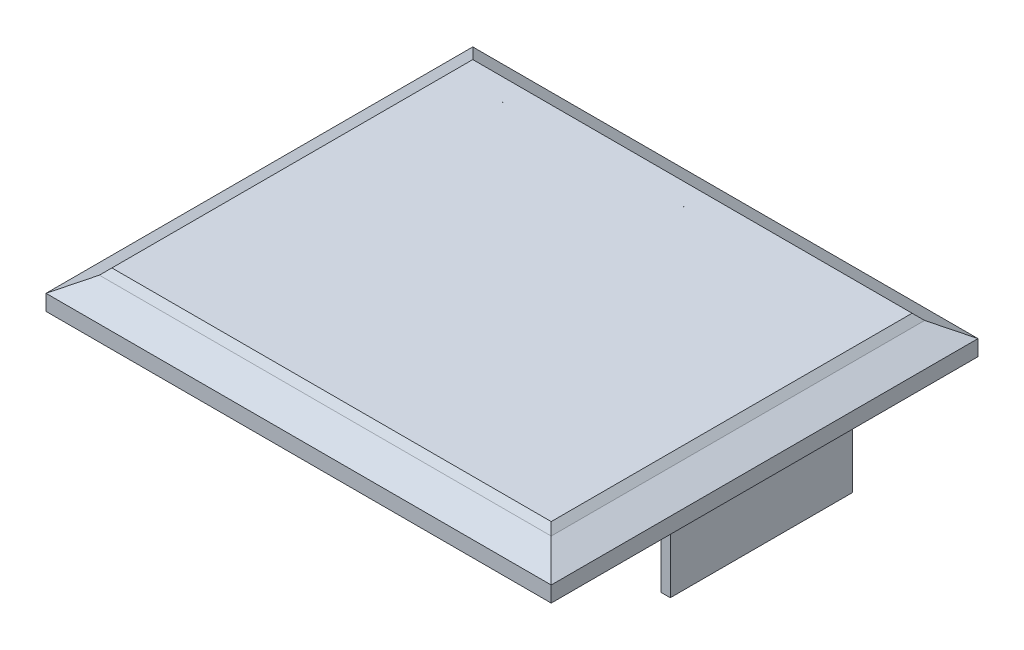
from build123d import *

# Parameters (mm, degrees)
SKETCH1_W           = 161
SKETCH1_H           = 136
BOSS_EXTRUDE1_DEPTH = 5
BOSS_EXTRUDE2_START = -10
SKETCH1_13_W        = 144
SKETCH1_13_H        = 119
BOSS_EXTRUDE2_DEPTH = 2
LOFT1_OUTLINE_W     = 144
LOFT1_OUTLINE_H     = 119
LOFT1_DEPTH         = 5
LOFT1_TAPER         = -59.5344551
CHAMFER1_SIZE       = 2
SKETCH1_14_W        = 144
SKETCH1_14_H        = 119
CUT_EXTRUDE1_DEPTH  = 8
CHAMFER2_SIZE       = 5
SKETCH1_15_W        = 38
SKETCH1_15_H        = 3
SKETCH1_15_W_2      = 3
SKETCH1_15_H_2      = 58
SKETCH1_15_H_3      = 28.62212407
BOSS_EXTRUDE3_DEPTH = 20
SKETCH1_18_R        = 6
CUT_EXTRUDE3_DEPTH  = 5.25
FILLET1_SIZE        = 2


with BuildPart() as part:
    # Sketch1 → Boss-Extrude1 (new body)
    with BuildSketch(Plane.XZ):
        with Locations((-6.029029402, -17.231063311)):
            Rectangle(SKETCH1_W, SKETCH1_H)
    extrude(amount=-BOSS_EXTRUDE1_DEPTH)

    # Loft1: read off the stored shape, not the designer's step
    # Loft1 outline → Loft1 (add)
    with BuildSketch(Plane(origin=(0, 10, 0), x_dir=(1, 0, 0), z_dir=(0, 1, 0))):
        with Locations((-6.029029402, 17.231063311)):
            Rectangle(LOFT1_OUTLINE_W, LOFT1_OUTLINE_H)
    extrude(amount=-LOFT1_DEPTH, taper=LOFT1_TAPER)

    # Sketch1<14> → Cut-Extrude1 (cut)
    with BuildSketch(Plane.XZ):
        with Locations((-6.029029402, -17.231063311)):
            Rectangle(SKETCH1_14_W, SKETCH1_14_H)
    extrude(amount=-CUT_EXTRUDE1_DEPTH, mode=Mode.SUBTRACT)

    # Chamfer2
    chamfer2_edges = [part.edges().sort_by_distance(p)[0] for p in [
        (-78.029029402, 8, -17.231063311),
        (-6.029029402, 8, 42.268936689),
        (65.970970598, 8, -17.231063311),
        (-6.029029402, 8, -76.731063311),
    ]]
    chamfer(chamfer2_edges, length=CHAMFER2_SIZE)

    # Sketch1<15> → Boss-Extrude3 (add)
    with BuildSketch(Plane.XZ):
        with Locations((2.342857194, -81.231063311)):
            Rectangle(SKETCH1_15_W, SKETCH1_15_H)
        with Locations((70.470970598, -18.679811546)):
            Rectangle(SKETCH1_15_W_2, SKETCH1_15_H_2)
        with Locations((-82.529029402, -5.323504441)):
            Rectangle(SKETCH1_15_W_2, SKETCH1_15_H_3)
    extrude(amount=BOSS_EXTRUDE3_DEPTH)

    # Sketch1<18> → Cut-Extrude3 (cut)
    with BuildSketch(Plane.XZ):
        with Locations((65.970970598, 42.268936689)):
            Circle(SKETCH1_18_R)
        with Locations((-78.029029402, 42.268936689)):
            Circle(SKETCH1_18_R)
        with Locations((-78.029029402, -76.731063311)):
            Circle(SKETCH1_18_R)
        with Locations((65.970970598, -76.731063311)):
            Circle(SKETCH1_18_R)
    extrude(amount=-CUT_EXTRUDE3_DEPTH, mode=Mode.SUBTRACT)

    # Fillet1
    # a fillet whose section is not a circle: 2 mm, written as the material it adds along each edge
    with BuildSketch(Plane(origin=(-16.657142806, 0, -82.731063311), x_dir=(0, 0, -1), z_dir=(1, 0, 0)), Plane(origin=(21.342857194, 0, -79.731063311), x_dir=(0, 0, 1), z_dir=(-1, 0, 0))) as fillet1_piece_1:
        with BuildLine():
            Bezier((FILLET1_SIZE, 0), (0, 0), (0, -FILLET1_SIZE), weights=[1, 0.428571429, 1])
            Line((0, -FILLET1_SIZE), (0, 0))
            Line((0, 0), (FILLET1_SIZE, 0))
        make_face()
    extrude(amount=38)
    with BuildSketch(Plane(origin=(-84.029029402, 0, 8.987557594), x_dir=(-1, 0, 0), z_dir=(0, 0, -1)), Plane(origin=(-81.029029402, 0, -19.634566476), x_dir=(1, 0, 0), z_dir=(0, 0, 1))) as fillet1_piece_2:
        with BuildLine():
            Bezier((FILLET1_SIZE, 0), (0, 0), (0, -FILLET1_SIZE), weights=[1, 0.428571429, 1])
            Line((0, -FILLET1_SIZE), (0, 0))
            Line((0, 0), (FILLET1_SIZE, 0))
        make_face()
    extrude(amount=28.62212407)
    with BuildSketch(Plane(origin=(71.970970598, 0, -47.679811546), x_dir=(1, 0, 0), z_dir=(0, 0, 1)), Plane(origin=(68.970970598, 0, 10.320188454), x_dir=(-1, 0, 0), z_dir=(0, 0, -1))) as fillet1_piece_3:
        with BuildLine():
            Bezier((FILLET1_SIZE, 0), (0, 0), (0, -FILLET1_SIZE), weights=[1, 0.428571429, 1])
            Line((0, -FILLET1_SIZE), (0, 0))
            Line((0, 0), (FILLET1_SIZE, 0))
        make_face()
    extrude(amount=58)
    with BuildSketch(Plane(origin=(-78.029029402, 5.25, 42.268936689), x_dir=(0.7048818539423626, 0, -0.7093247295722728), z_dir=(0.7093247295722728, 0, 0.7048818539423626))) as fillet1_piece_4_section:
        with BuildLine():
            Bezier((6 - FILLET1_SIZE, 0), (6, 0), (6, -FILLET1_SIZE), weights=[1, 0.428571429, 1])
            Line((6, -FILLET1_SIZE), (6, 0))
            Line((6, 0), (6 - FILLET1_SIZE, 0))
        make_face()
    fillet1_piece_4 = revolve(axis=Axis((-78.029029402, 5.25, 42.268936689), (0, 1, 0)), revolution_arc=359.64, mode=Mode.PRIVATE)
    fillet1_piece_4 = split(fillet1_piece_4, bisect_by=Plane(origin=(-78.029029402, 4.125, 41.143936689), z_dir=(0, -0.7071067811865476, -0.7071067811865476)), keep=Keep.TOP, mode=Mode.PRIVATE)
    fillet1_piece_4 = split(fillet1_piece_4, bisect_by=Plane(origin=(-76.904029402, 4.125, 42.268936689), z_dir=(-0.7071067811865476, 0.7071067811865476, 0)), keep=Keep.TOP, mode=Mode.PRIVATE)
    add(fillet1_piece_4)
    with BuildSketch(Plane(origin=(-78.029029402, 5.25, 42.268936689), x_dir=(0.7048818539423626, 0, -0.7093247295722728), z_dir=(0.7093247295722728, 0, 0.7048818539423626))) as fillet1_piece_5_section:
        with BuildLine():
            Bezier((6 - FILLET1_SIZE, 0), (6, 0), (6, -FILLET1_SIZE), weights=[1, 0.428571429, 1])
            Line((6, -FILLET1_SIZE), (6, 0))
            Line((6, 0), (6 - FILLET1_SIZE, 0))
        make_face()
    fillet1_piece_5 = revolve(axis=Axis((-78.029029402, 5.25, 42.268936689), (0, 1, 0)), revolution_arc=359.64, mode=Mode.PRIVATE)
    fillet1_piece_5 = split(fillet1_piece_5, bisect_by=Plane(origin=(-78.029029402, 4.125, 41.143936689), z_dir=(0, 0.7071067811865476, 0.7071067811865476)), keep=Keep.TOP, mode=Mode.PRIVATE)
    fillet1_piece_5 = split(fillet1_piece_5, bisect_by=Plane(origin=(-76.904029402, 4.125, 42.268936689), z_dir=(-0.7071067811865476, 0.7071067811865476, 0)), keep=Keep.TOP, mode=Mode.PRIVATE)
    add(fillet1_piece_5)
    with BuildSketch(Plane(origin=(-78.029029402, 5.25, 42.268936689), x_dir=(0.7048818539423626, 0, -0.7093247295722728), z_dir=(0.7093247295722728, 0, 0.7048818539423626))) as fillet1_piece_6_section:
        with BuildLine():
            Bezier((6 - FILLET1_SIZE, 0), (6, 0), (6, -FILLET1_SIZE), weights=[1, 0.428571429, 1])
            Line((6, -FILLET1_SIZE), (6, 0))
            Line((6, 0), (6 - FILLET1_SIZE, 0))
        make_face()
    fillet1_piece_6 = revolve(axis=Axis((-78.029029402, 5.25, 42.268936689), (0, 1, 0)), revolution_arc=359.64, mode=Mode.PRIVATE)
    fillet1_piece_6 = split(fillet1_piece_6, bisect_by=Plane(origin=(-78.029029402, 4.125, 41.143936689), z_dir=(0, 0.7071067811865476, 0.7071067811865476)), keep=Keep.TOP, mode=Mode.PRIVATE)
    fillet1_piece_6 = split(fillet1_piece_6, bisect_by=Plane(origin=(-76.904029402, 4.125, 42.268936689), z_dir=(0.7071067811865476, -0.7071067811865476, 0)), keep=Keep.TOP, mode=Mode.PRIVATE)
    add(fillet1_piece_6)
    with BuildSketch(Plane(origin=(65.970970598, 5.25, 42.268936689), x_dir=(-0.7093247295722728, 0, -0.7048818539423626), z_dir=(0.7048818539423626, 0, -0.7093247295722728))) as fillet1_piece_7_section:
        with BuildLine():
            Bezier((6 - FILLET1_SIZE, 0), (6, 0), (6, -FILLET1_SIZE), weights=[1, 0.428571429, 1])
            Line((6, -FILLET1_SIZE), (6, 0))
            Line((6, 0), (6 - FILLET1_SIZE, 0))
        make_face()
    fillet1_piece_7 = revolve(axis=Axis((65.970970598, 5.25, 42.268936689), (0, 1, 0)), revolution_arc=359.64, mode=Mode.PRIVATE)
    fillet1_piece_7 = split(fillet1_piece_7, bisect_by=Plane(origin=(65.970970598, 4.125, 41.143936689), z_dir=(0, 0.7071067811865476, 0.7071067811865476)), keep=Keep.TOP, mode=Mode.PRIVATE)
    fillet1_piece_7 = split(fillet1_piece_7, bisect_by=Plane(origin=(64.845970598, 4.125, 42.268936689), z_dir=(-0.7071067811865476, -0.7071067811865476, 0)), keep=Keep.TOP, mode=Mode.PRIVATE)
    add(fillet1_piece_7)
    with BuildSketch(Plane(origin=(65.970970598, 5.25, 42.268936689), x_dir=(-0.7093247295722728, 0, -0.7048818539423626), z_dir=(0.7048818539423626, 0, -0.7093247295722728))) as fillet1_piece_8_section:
        with BuildLine():
            Bezier((6 - FILLET1_SIZE, 0), (6, 0), (6, -FILLET1_SIZE), weights=[1, 0.428571429, 1])
            Line((6, -FILLET1_SIZE), (6, 0))
            Line((6, 0), (6 - FILLET1_SIZE, 0))
        make_face()
    fillet1_piece_8 = revolve(axis=Axis((65.970970598, 5.25, 42.268936689), (0, 1, 0)), revolution_arc=359.64, mode=Mode.PRIVATE)
    fillet1_piece_8 = split(fillet1_piece_8, bisect_by=Plane(origin=(65.970970598, 4.125, 41.143936689), z_dir=(0, 0.7071067811865476, 0.7071067811865476)), keep=Keep.TOP, mode=Mode.PRIVATE)
    fillet1_piece_8 = split(fillet1_piece_8, bisect_by=Plane(origin=(64.845970598, 4.125, 42.268936689), z_dir=(0.7071067811865476, 0.7071067811865476, 0)), keep=Keep.TOP, mode=Mode.PRIVATE)
    add(fillet1_piece_8)
    with BuildSketch(Plane(origin=(65.970970598, 5.25, 42.268936689), x_dir=(-0.7093247295722728, 0, -0.7048818539423626), z_dir=(0.7048818539423626, 0, -0.7093247295722728))) as fillet1_piece_9_section:
        with BuildLine():
            Bezier((6 - FILLET1_SIZE, 0), (6, 0), (6, -FILLET1_SIZE), weights=[1, 0.428571429, 1])
            Line((6, -FILLET1_SIZE), (6, 0))
            Line((6, 0), (6 - FILLET1_SIZE, 0))
        make_face()
    fillet1_piece_9 = revolve(axis=Axis((65.970970598, 5.25, 42.268936689), (0, 1, 0)), revolution_arc=359.64, mode=Mode.PRIVATE)
    fillet1_piece_9 = split(fillet1_piece_9, bisect_by=Plane(origin=(65.970970598, 4.125, 41.143936689), z_dir=(0, -0.7071067811865476, -0.7071067811865476)), keep=Keep.TOP, mode=Mode.PRIVATE)
    fillet1_piece_9 = split(fillet1_piece_9, bisect_by=Plane(origin=(64.845970598, 4.125, 42.268936689), z_dir=(0.7071067811865476, 0.7071067811865476, 0)), keep=Keep.TOP, mode=Mode.PRIVATE)
    add(fillet1_piece_9)
    with BuildSketch(Plane(origin=(-78.029029402, 5.25, -76.731063311), x_dir=(0.7093247295722739, 0, 0.7048818539423612), z_dir=(-0.7048818539423612, 0, 0.7093247295722739))) as fillet1_piece_10_section:
        with BuildLine():
            Bezier((6, -FILLET1_SIZE), (6, 0), (6 - FILLET1_SIZE, 0), weights=[1, 0.428571429, 1])
            Line((6 - FILLET1_SIZE, 0), (6, 0))
            Line((6, 0), (6, -FILLET1_SIZE))
        make_face()
    fillet1_piece_10 = revolve(axis=Axis((-78.029029402, 5.25, -76.731063311), (0, 1, 0)), revolution_arc=359.64, mode=Mode.PRIVATE)
    fillet1_piece_10 = split(fillet1_piece_10, bisect_by=Plane(origin=(-76.904029402, 4.125, -76.731063311), z_dir=(0.7071067811865476, -0.7071067811865476, 0)), keep=Keep.TOP, mode=Mode.PRIVATE)
    fillet1_piece_10 = split(fillet1_piece_10, bisect_by=Plane(origin=(-78.029029402, 4.125, -75.606063311), z_dir=(0, 0.7071067811865476, -0.7071067811865476)), keep=Keep.TOP, mode=Mode.PRIVATE)
    add(fillet1_piece_10)
    with BuildSketch(Plane(origin=(-78.029029402, 5.25, -76.731063311), x_dir=(0.7093247295722739, 0, 0.7048818539423612), z_dir=(-0.7048818539423612, 0, 0.7093247295722739))) as fillet1_piece_11_section:
        with BuildLine():
            Bezier((6, -FILLET1_SIZE), (6, 0), (6 - FILLET1_SIZE, 0), weights=[1, 0.428571429, 1])
            Line((6 - FILLET1_SIZE, 0), (6, 0))
            Line((6, 0), (6, -FILLET1_SIZE))
        make_face()
    fillet1_piece_11 = revolve(axis=Axis((-78.029029402, 5.25, -76.731063311), (0, 1, 0)), revolution_arc=359.64, mode=Mode.PRIVATE)
    fillet1_piece_11 = split(fillet1_piece_11, bisect_by=Plane(origin=(-76.904029402, 4.125, -76.731063311), z_dir=(-0.7071067811865476, 0.7071067811865476, 0)), keep=Keep.TOP, mode=Mode.PRIVATE)
    fillet1_piece_11 = split(fillet1_piece_11, bisect_by=Plane(origin=(-78.029029402, 4.125, -75.606063311), z_dir=(0, 0.7071067811865476, -0.7071067811865476)), keep=Keep.TOP, mode=Mode.PRIVATE)
    add(fillet1_piece_11)
    with BuildSketch(Plane(origin=(-78.029029402, 5.25, -76.731063311), x_dir=(0.7093247295722739, 0, 0.7048818539423612), z_dir=(-0.7048818539423612, 0, 0.7093247295722739))) as fillet1_piece_12_section:
        with BuildLine():
            Bezier((6, -FILLET1_SIZE), (6, 0), (6 - FILLET1_SIZE, 0), weights=[1, 0.428571429, 1])
            Line((6 - FILLET1_SIZE, 0), (6, 0))
            Line((6, 0), (6, -FILLET1_SIZE))
        make_face()
    fillet1_piece_12 = revolve(axis=Axis((-78.029029402, 5.25, -76.731063311), (0, 1, 0)), revolution_arc=359.64, mode=Mode.PRIVATE)
    fillet1_piece_12 = split(fillet1_piece_12, bisect_by=Plane(origin=(-76.904029402, 4.125, -76.731063311), z_dir=(-0.7071067811865476, 0.7071067811865476, 0)), keep=Keep.TOP, mode=Mode.PRIVATE)
    fillet1_piece_12 = split(fillet1_piece_12, bisect_by=Plane(origin=(-78.029029402, 4.125, -75.606063311), z_dir=(0, -0.7071067811865476, 0.7071067811865476)), keep=Keep.TOP, mode=Mode.PRIVATE)
    add(fillet1_piece_12)
    with BuildSketch(Plane(origin=(65.970970598, 5.25, -76.731063311), x_dir=(-0.7048818539423612, 0, 0.7093247295722739), z_dir=(-0.7093247295722739, 0, -0.7048818539423612))) as fillet1_piece_13_section:
        with BuildLine():
            Bezier((6, -FILLET1_SIZE), (6, 0), (6 - FILLET1_SIZE, 0), weights=[1, 0.428571429, 1])
            Line((6 - FILLET1_SIZE, 0), (6, 0))
            Line((6, 0), (6, -FILLET1_SIZE))
        make_face()
    fillet1_piece_13 = revolve(axis=Axis((65.970970598, 5.25, -76.731063311), (0, 1, 0)), revolution_arc=359.64, mode=Mode.PRIVATE)
    fillet1_piece_13 = split(fillet1_piece_13, bisect_by=Plane(origin=(64.845970598, 4.125, -76.731063311), z_dir=(0.7071067811865476, 0.7071067811865476, 0)), keep=Keep.TOP, mode=Mode.PRIVATE)
    fillet1_piece_13 = split(fillet1_piece_13, bisect_by=Plane(origin=(65.970970598, 4.125, -75.606063311), z_dir=(0, -0.7071067811865476, 0.7071067811865476)), keep=Keep.TOP, mode=Mode.PRIVATE)
    add(fillet1_piece_13)
    with BuildSketch(Plane(origin=(65.970970598, 5.25, -76.731063311), x_dir=(-0.7048818539423612, 0, 0.7093247295722739), z_dir=(-0.7093247295722739, 0, -0.7048818539423612))) as fillet1_piece_14_section:
        with BuildLine():
            Bezier((6, -FILLET1_SIZE), (6, 0), (6 - FILLET1_SIZE, 0), weights=[1, 0.428571429, 1])
            Line((6 - FILLET1_SIZE, 0), (6, 0))
            Line((6, 0), (6, -FILLET1_SIZE))
        make_face()
    fillet1_piece_14 = revolve(axis=Axis((65.970970598, 5.25, -76.731063311), (0, 1, 0)), revolution_arc=359.64, mode=Mode.PRIVATE)
    fillet1_piece_14 = split(fillet1_piece_14, bisect_by=Plane(origin=(64.845970598, 4.125, -76.731063311), z_dir=(0.7071067811865476, 0.7071067811865476, 0)), keep=Keep.TOP, mode=Mode.PRIVATE)
    fillet1_piece_14 = split(fillet1_piece_14, bisect_by=Plane(origin=(65.970970598, 4.125, -75.606063311), z_dir=(0, 0.7071067811865476, -0.7071067811865476)), keep=Keep.TOP, mode=Mode.PRIVATE)
    add(fillet1_piece_14)
    with BuildSketch(Plane(origin=(65.970970598, 5.25, -76.731063311), x_dir=(-0.7048818539423612, 0, 0.7093247295722739), z_dir=(-0.7093247295722739, 0, -0.7048818539423612))) as fillet1_piece_15_section:
        with BuildLine():
            Bezier((6, -FILLET1_SIZE), (6, 0), (6 - FILLET1_SIZE, 0), weights=[1, 0.428571429, 1])
            Line((6 - FILLET1_SIZE, 0), (6, 0))
            Line((6, 0), (6, -FILLET1_SIZE))
        make_face()
    fillet1_piece_15 = revolve(axis=Axis((65.970970598, 5.25, -76.731063311), (0, 1, 0)), revolution_arc=359.64, mode=Mode.PRIVATE)
    fillet1_piece_15 = split(fillet1_piece_15, bisect_by=Plane(origin=(64.845970598, 4.125, -76.731063311), z_dir=(-0.7071067811865476, -0.7071067811865476, 0)), keep=Keep.TOP, mode=Mode.PRIVATE)
    fillet1_piece_15 = split(fillet1_piece_15, bisect_by=Plane(origin=(65.970970598, 4.125, -75.606063311), z_dir=(0, 0.7071067811865476, -0.7071067811865476)), keep=Keep.TOP, mode=Mode.PRIVATE)
    add(fillet1_piece_15)


with BuildPart() as body_2:
    # Sketch1<13> → Boss-Extrude2 (new body)
    with BuildSketch(Plane.XZ.offset(BOSS_EXTRUDE2_START)):
        with Locations((-6.029029402, -17.231063311)):
            Rectangle(SKETCH1_13_W, SKETCH1_13_H)
    extrude(amount=-BOSS_EXTRUDE2_DEPTH)

    # Chamfer1
    chamfer1_edges = [body_2.edges().sort_by_distance(p)[0] for p in [
        (-6.029029402, 12, -76.731063311),
        (-78.029029402, 12, -17.231063311),
        (-6.029029402, 12, 42.268936689),
        (65.970970598, 12, -17.231063311),
    ]]
    chamfer(chamfer1_edges, length=CHAMFER1_SIZE - 0.0001)  # a hair under: the kernel refuses the full size


solid = Compound([part.part, body_2.part])
